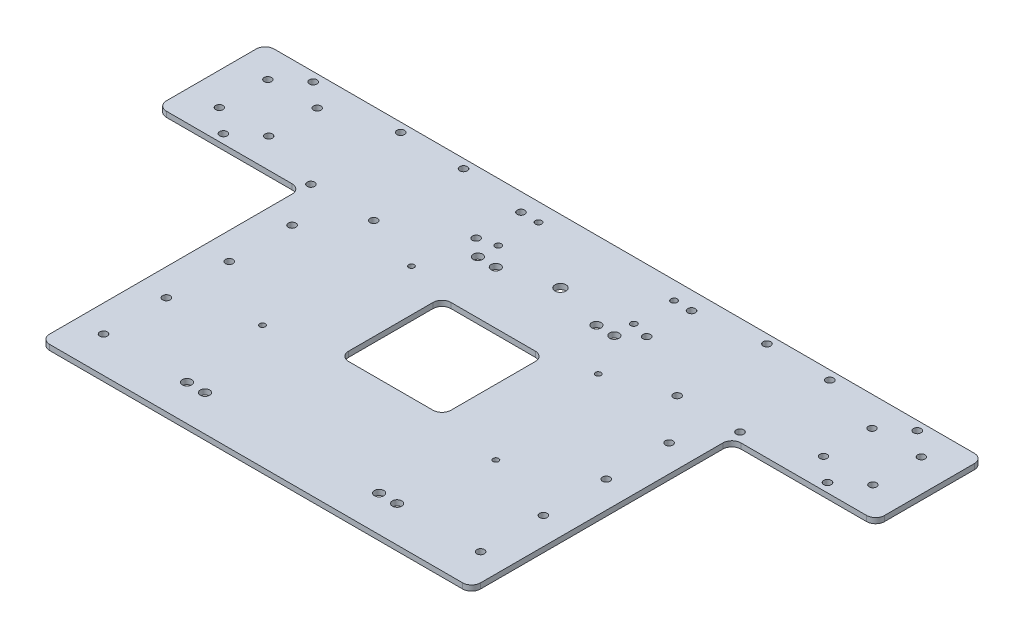
from build123d import *

# Parameters (mm, degrees)
SKETCH_1_R          = 2.1
SKETCH_1_R_2        = 3.05
SKETCH_1_W          = 57
SKETCH_1_H          = 57
EXTRUDE_1378_DEPTH  = 3
SKETCH_2_R          = 2.05
SKETCH_2_R_2        = 2.1
CUT_EXTRUDE_1_DEPTH = 285.15708598
FILLET_1_R          = 5
SKETCH_3_R          = 2.1
SKETCH_3_R_2        = 1.55
SKETCH_3_R_3        = 2.6
CUT_EXTRUDE_2_DEPTH = 285.15708598
SKETCH_4_R          = 1.75
CUT_EXTRUDE_3_DEPTH = 10


with BuildPart() as part:
    # 草图1 → Extrude 1378 (new body)
    with BuildSketch(Plane(origin=(0, 0, 0), x_dir=(1, 0, 0), z_dir=(0, 1, 0))):
        Polygon((-164.424075228, 46.128249268), (-164.424075228, -13.871750732), (-84.424075228, -13.871750732), (-84.424075228, -158.871750732), (155.575924772, -158.871750732), (155.575924772, -13.871750732), (235.575924772, -13.871750732), (235.575924772, 46.128249268), align=None)
        with Locations((-11.924075228, 11.128249268)):
            Circle(SKETCH_1_R, mode=Mode.SUBTRACT)
        with Locations((-11.924075228, 36.128249268)):
            Circle(SKETCH_1_R, mode=Mode.SUBTRACT)
        with Locations((35.575924772, 10.628249268)):
            Circle(SKETCH_1_R_2, mode=Mode.SUBTRACT)
        with Locations((83.075924772, 11.128249268)):
            Circle(SKETCH_1_R, mode=Mode.SUBTRACT)
        with Locations((83.075924772, 36.128249268)):
            Circle(SKETCH_1_R, mode=Mode.SUBTRACT)
        with Locations((35.575924772, -55.371750732)):
            Rectangle(SKETCH_1_W, SKETCH_1_H, mode=Mode.SUBTRACT)
    extrude(amount=EXTRUDE_1378_DEPTH)

    # 草图2 → 切除-拉伸1 (cut, through all)
    with BuildSketch(Plane(origin=(0, 3, 0), x_dir=(1, 0, 0), z_dir=(0, 1, 0))):
        with Locations((-146.424075228, 29.628249268)):
            Circle(SKETCH_2_R)
        with Locations((-146.424075228, 2.628249268)):
            Circle(SKETCH_2_R)
        with Locations((-118.924075228, 29.628249268)):
            Circle(SKETCH_2_R)
        with Locations((-118.924075228, 2.628249268)):
            Circle(SKETCH_2_R)
        with Locations((-48.924075228, 41.128249268)):
            Circle(SKETCH_2_R_2)
        with Locations((-83.924075228, 41.128249268)):
            Circle(SKETCH_2_R_2)
        with Locations((-48.924075228, -8.871750732)):
            Circle(SKETCH_2_R_2)
        with Locations((-83.924075228, -8.871750732)):
            Circle(SKETCH_2_R_2)
        with Locations((-132.674075228, 41.128249268)):
            Circle(SKETCH_2_R_2)
        with Locations((-132.674075228, -8.871750732)):
            Circle(SKETCH_2_R_2)
        with Locations((203.825924772, -8.871750732)):
            Circle(SKETCH_2_R_2)
        with Locations((203.825924772, 41.128249268)):
            Circle(SKETCH_2_R_2)
        with Locations((155.075924772, -8.871750732)):
            Circle(SKETCH_2_R_2)
        with Locations((120.075924772, -8.871750732)):
            Circle(SKETCH_2_R_2)
        with Locations((155.075924772, 41.128249268)):
            Circle(SKETCH_2_R_2)
        with Locations((120.075924772, 41.128249268)):
            Circle(SKETCH_2_R_2)
        with Locations((190.075924772, 2.628249268)):
            Circle(SKETCH_2_R)
        with Locations((190.075924772, 29.628249268)):
            Circle(SKETCH_2_R)
        with Locations((217.575924772, 2.628249268)):
            Circle(SKETCH_2_R)
        with Locations((217.575924772, 29.628249268)):
            Circle(SKETCH_2_R)
    extrude(amount=-CUT_EXTRUDE_1_DEPTH, mode=Mode.SUBTRACT)

    # 圆角1
    fillet_1_edges = [part.edges().sort_by_distance(p)[0] for p in [
        (155.575924772, 1.5, 13.871750732),
        (-84.424075228, 1.5, 13.871750732),
        (235.575924772, 1.5, -46.128249268),
        (235.575924772, 1.5, 13.871750732),
        (155.575924772, 1.5, 158.871750732),
        (-84.424075228, 1.5, 158.871750732),
        (-164.424075228, 1.5, -46.128249268),
        (-164.424075228, 1.5, 13.871750732),
        (7.075924772, 1.5, 83.871750732),
        (64.075924772, 1.5, 83.871750732),
        (64.075924772, 1.5, 26.871750732),
        (7.075924772, 1.5, 26.871750732),
    ]]
    fillet(fillet_1_edges, radius=FILLET_1_R)

    # 草图3 → 切除-拉伸2 (cut, through all)
    with BuildSketch(Plane(origin=(0, 3, 0), x_dir=(1, 0, 0), z_dir=(0, 1, 0))):
        with Locations((-69.424075228, -33.871750732)):
            Circle(SKETCH_3_R)
        with Locations((-69.424075228, -68.871750732)):
            Circle(SKETCH_3_R)
        with Locations((-69.424075228, -103.871750732)):
            Circle(SKETCH_3_R)
        with Locations((-69.424075228, -138.871750732)):
            Circle(SKETCH_3_R)
        with Locations((140.575924772, -138.871750732)):
            Circle(SKETCH_3_R)
        with Locations((140.575924772, -103.871750732)):
            Circle(SKETCH_3_R)
        with Locations((140.575924772, -68.871750732)):
            Circle(SKETCH_3_R)
        with Locations((140.575924772, -33.871750732)):
            Circle(SKETCH_3_R)
        with Locations((-16.424075228, -20.371750732)):
            Circle(SKETCH_3_R_2)
        with Locations((-29.424075228, -90.371750732)):
            Circle(SKETCH_3_R_2)
        with Locations((100.575924772, -90.371750732)):
            Circle(SKETCH_3_R_2)
        with Locations((87.575924772, -20.371750732)):
            Circle(SKETCH_3_R_2)
        with Locations((-2.424075228, 2.628249268)):
            Circle(SKETCH_3_R_3)
        with Locations((7.575924772, 2.628249268)):
            Circle(SKETCH_3_R_3)
        with Locations((63.575924772, 2.628249268)):
            Circle(SKETCH_3_R_3)
        with Locations((73.575924772, 2.628249268)):
            Circle(SKETCH_3_R_3)
        with Locations((-22.924075228, -138.871750732)):
            Circle(SKETCH_3_R_3)
        with Locations((-12.924075228, -138.871750732)):
            Circle(SKETCH_3_R_3)
        with Locations((84.075924772, -138.871750732)):
            Circle(SKETCH_3_R_3)
        with Locations((94.075924772, -138.871750732)):
            Circle(SKETCH_3_R_3)
    extrude(amount=-CUT_EXTRUDE_2_DEPTH, mode=Mode.SUBTRACT)

    # 草图4 → 切除-拉伸3 (cut)
    with BuildSketch(Plane(origin=(0, 3, 0), x_dir=(1, 0, 0), z_dir=(0, 1, 0))):
        with Locations((-2.174075228, 36.128249268)):
            Circle(SKETCH_4_R)
        with Locations((73.325924772, 36.128249268)):
            Circle(SKETCH_4_R)
        with Locations((-2.174075228, 13.728249268)):
            Circle(SKETCH_4_R)
        with Locations((73.325924772, 13.728249268)):
            Circle(SKETCH_4_R)
    extrude(amount=-CUT_EXTRUDE_3_DEPTH, mode=Mode.SUBTRACT)


solid = part.part
